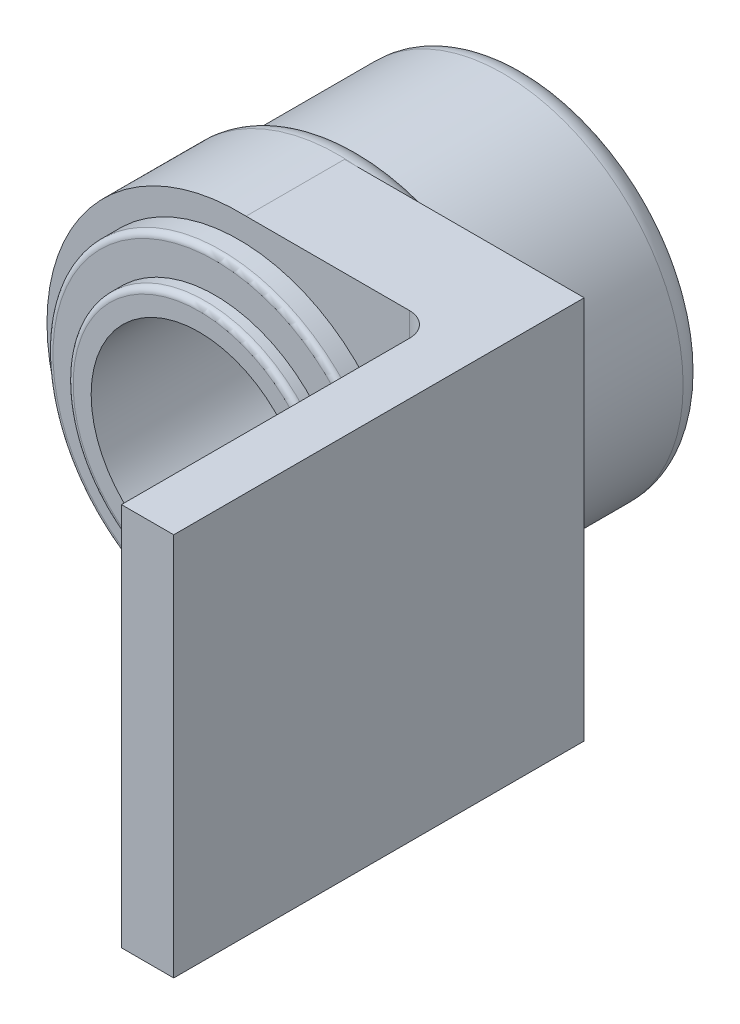
from build123d import *

# Parameters (mm, degrees)
SKETCH1_R           = 19.05
BOSS_EXTRUDE1_DEPTH = 17.78
SKETCH2_R           = 10.16
CUT_EXTRUDE1_DEPTH  = 1.27
FILLET1_R           = 2.54
FILLET2_R           = 2.54
SKETCH3_R           = 20.32
BOSS_EXTRUDE2_DEPTH = 12.7
FILLET3_R           = 2.54
SKETCH4_R           = 17.78
BOSS_EXTRUDE3_DEPTH = 2.54
SKETCH5_R           = 13.97
BOSS_EXTRUDE4_DEPTH = 1.6764
FILLET5_R           = 0.635
SKETCH6_R           = 11.43
CUT_EXTRUDE2_DEPTH  = 33.02
BOSS_EXTRUDE6_DEPTH = 10.414
SKETCH9_W           = 5.530491266
SKETCH9_H           = 40.61393848
BOSS_EXTRUDE7_DEPTH = 33.02
FILLET6_START       = -20.30755603
FILLET6_DEPTH       = 40.61393848
FILLET6_START_2     = 30.48
FILLET6_2_DEPTH     = 2.52


with BuildPart() as part:
    # Sketch1 → Boss-Extrude1 (new body)
    with BuildSketch(Plane.XY):
        Circle(SKETCH1_R)
    extrude(amount=BOSS_EXTRUDE1_DEPTH)

    # Sketch2 → Cut-Extrude1 (cut)
    with BuildSketch(Plane(origin=(0, 0, 0), x_dir=(-1, 0, 0), z_dir=(0, 0, -1))):
        Circle(SKETCH2_R)
    extrude(amount=-CUT_EXTRUDE1_DEPTH, mode=Mode.SUBTRACT)

    # Fillet1
    # the kernel refuses this fillet: 2.54 mm, written as the material it takes off along each edge
    with BuildSketch(Plane(origin=(0, 0, 0), x_dir=(-1, 0, 0), z_dir=(0, -1, 0))) as fillet1_piece_1:
        with BuildLine():
            CenterArc((12.359704526, -2.54), FILLET1_R, 90, 60)
            Line((10.16, -1.27), (10.116005909, -1.2446))
            ThreePointArc((10.116005909, -1.2446), (10.1092, -0.635), (10.1092, 0))
            Line((10.1092, 0), (10.16, 0.0508))
            Line((10.16, 0.0508), (12.359704526, 0.0508))
            Line((12.359704526, 0.0508), (12.359704526, 0))
        make_face()
    revolve(axis=Axis((0, 0, 0), (0, 0, -1)), mode=Mode.SUBTRACT)

    # Fillet2
    fillet2_edges = [part.edges().sort_by_distance(p)[0] for p in [
        (-19.05, 0, 0),
    ]]
    fillet(fillet2_edges, radius=FILLET2_R)

    # Sketch3 → Boss-Extrude2 (add)
    with BuildSketch(Plane.XY.offset(17.78)):
        Circle(SKETCH3_R)
    extrude(amount=BOSS_EXTRUDE2_DEPTH)

    # Fillet3
    # the kernel refuses this fillet: 2.54 mm, written as the material it takes off along each edge
    with BuildSketch(Plane(origin=(0, 0, 17.78), x_dir=(1, 0, 0), z_dir=(0, -1, 0))) as fillet3_piece_1:
        with BuildLine():
            CenterArc((17.78, 2.199704526), FILLET3_R, 300, 60)
            Line((19.05, 0), (19.0754, -0.043994091))
            ThreePointArc((19.0754, -0.043994091), (19.685, -0.0508), (20.32, -0.0508))
            Line((20.32, -0.0508), (20.3708, 0))
            Line((20.3708, 0), (20.3708, 2.199704526))
            Line((20.3708, 2.199704526), (20.32, 2.199704526))
        make_face()
    revolve(axis=Axis((0, 0, 17.78), (0, 0, 1)), mode=Mode.SUBTRACT)

    # Sketch4 → Boss-Extrude3 (add)
    with BuildSketch(Plane.XY.offset(30.48)):
        Circle(SKETCH4_R)
    extrude(amount=BOSS_EXTRUDE3_DEPTH)

    # Sketch5 → Boss-Extrude4 (add)
    with BuildSketch(Plane.XY.offset(33.02)):
        Circle(SKETCH5_R)
    extrude(amount=BOSS_EXTRUDE4_DEPTH)

    # Fillet5
    fillet5_edges = [part.edges().sort_by_distance(p)[0] for p in [
        (-17.78, 0, 33.02),
        (-13.97, 0, 34.6964),
    ]]
    fillet(fillet5_edges, radius=FILLET5_R)

    # Sketch6 → Cut-Extrude2 (cut)
    with BuildSketch(Plane.XY.offset(34.6964)):
        Circle(SKETCH6_R)
    extrude(amount=-CUT_EXTRUDE2_DEPTH, mode=Mode.SUBTRACT)

    # Sketch7 → Boss-Extrude6 (add)
    with BuildSketch(Plane.XY.offset(30.48)):
        with BuildLine():
            Line((0.71103311, -20.30755603), (26.11103311, -20.30755603))
            Line((26.11103311, -20.30755603), (26.11103311, 20.30638245))
            Line((26.11103311, 20.30638245), (0.743795542, 20.30638245))
            Line((0.743795542, 20.30638245), (0.743795542, 19.03638245))
            add(Edge.make_bspline(
                [(0.71103311, -19.03755603), (10.719056995, -19.88065927), (29.921844126, -0.322882605), (10.700257888, 19.398993092), (0.743795542, 19.03638245)],
                knots=[0, 0, 0, 0, 0.495916673, 1, 1, 1, 1], degree=3))
            Line((0.71103311, -19.03755603), (0.71103311, -20.30755603))
        make_face()
    extrude(amount=-BOSS_EXTRUDE6_DEPTH)

    # Sketch9 → Boss-Extrude7 (add)
    with BuildSketch(Plane.XY.offset(30.48)):
        with Locations((23.345787477, -0.00058679)):
            Rectangle(SKETCH9_W, SKETCH9_H)
    extrude(amount=BOSS_EXTRUDE7_DEPTH)

    # Fillet6: read off the stored shape, not the designer's step
    # Fillet6 outline → Fillet6 (add)
    with BuildSketch(Plane(origin=(0, 0, 0), x_dir=(1, 0, 0), z_dir=(0, 1, 0)).offset(FILLET6_START)):
        with BuildLine():
            Line((20.580541844, -30.48), (18.040541844, -30.48))
            ThreePointArc((18.040541844, -30.48), (19.836593068, -31.223948776), (20.580541844, -33.02))
            Line((20.580541844, -33.02), (20.580541844, -30.48))
        make_face()
    extrude(amount=FILLET6_DEPTH)

    # Fillet6 2 outline → Fillet6 2 (cut)
    with BuildSketch(Plane.XY.offset(FILLET6_START_2)):
        with BuildLine():
            add(Edge.make_bspline(
                [(20.315186876, -0.442246776), (20.310692243, -1.040693916), (20.270518605, -1.638988681), (20.196745769, -2.234694689)],
                knots=[0.504083327, 0.504083327, 0.504083327, 0.504083327, 0.534555468, 0.534555468, 0.534555468, 0.534555468], degree=3))
            ThreePointArc((20.315186876, -0.442246776), (20.275783315, -1.339780197), (20.196745769, -2.234694689))
        make_face()
    extrude(amount=FILLET6_2_DEPTH, mode=Mode.SUBTRACT)


solid = part.part
